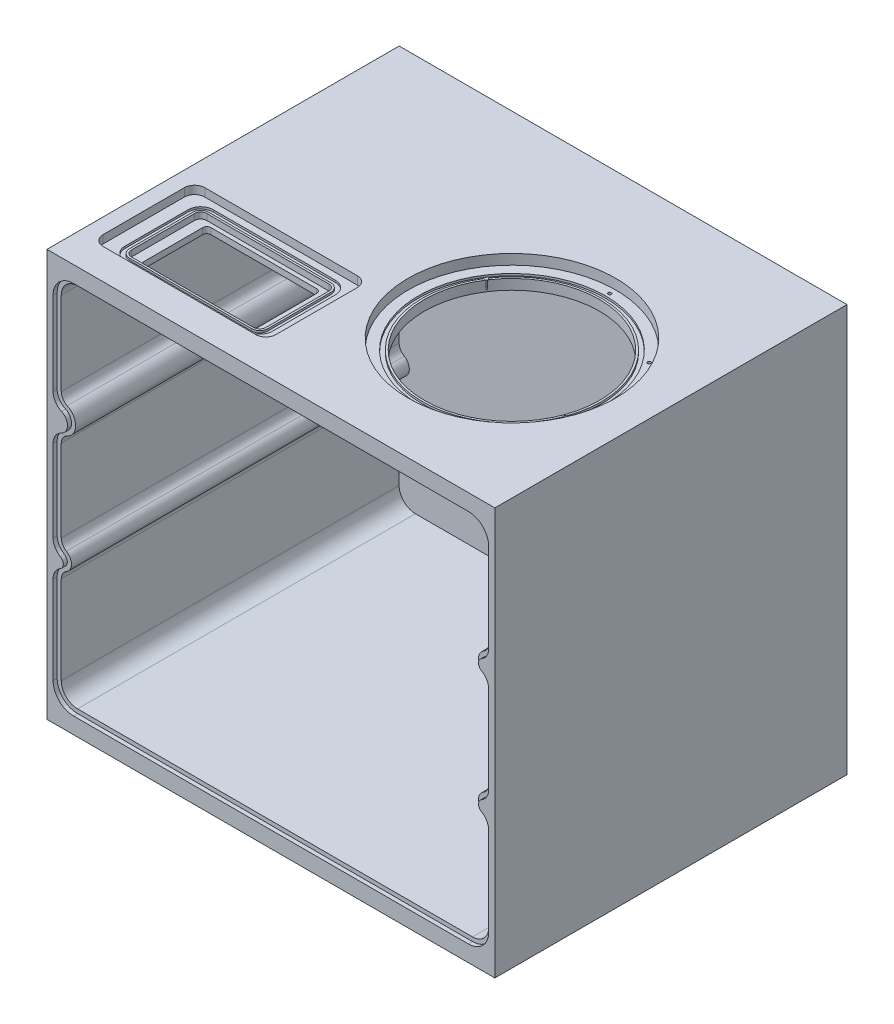
from build123d import *

# Parameters (mm, degrees)
SKETCH1_W           = 220
SKETCH1_H           = 200
BOSS_EXTRUDE1_DEPTH = 5
SKETCH1_3_W         = 220
SKETCH1_3_H         = 200
BOSS_EXTRUDE2_DEPTH = 173
FILLET1_R           = 8
FILLET2_R           = 5
SKETCH4_R           = 43
CUT_EXTRUDE3_DEPTH  = 10
SKETCH4_3_R         = 51
CUT_EXTRUDE4_DEPTH  = 5
SKETCH4_5_R         = 46
SKETCH4_5_R_2       = 44
CUT_EXTRUDE6_DEPTH  = 6
CUT_EXTRUDE9_DEPTH  = 2
SKETCH5_R           = 0.7835
CUT_EXTRUDE7_DEPTH  = 4
SKETCH6_W           = 56
SKETCH6_H           = 33
CUT_EXTRUDE8_DEPTH  = 10
SKETCH6_3_W         = 85
SKETCH6_3_H         = 50
CUT_EXTRUDE10_DEPTH = 4
SKETCH6_4_W         = 66
SKETCH6_4_H         = 37
SKETCH6_4_W_2       = 56
SKETCH6_4_H_2       = 33
CUT_EXTRUDE11_DEPTH = 7
SKETCH6_5_W         = 72.4
SKETCH6_5_H         = 43.4
SKETCH6_5_W_2       = 68
SKETCH6_5_H_2       = 39
CUT_EXTRUDE12_DEPTH = 5
FILLET3_R           = 2
FILLET4_R           = 3
FILLET5_R           = 4
FILLET6_R           = 6.2
FILLET7_R           = 5


with BuildPart() as part:
    # Sketch1 → Boss-Extrude1 (new body)
    with BuildSketch(Plane.XY):
        Rectangle(SKETCH1_W, SKETCH1_H)
    extrude(amount=BOSS_EXTRUDE1_DEPTH)

    # Sketch1<3> → Boss-Extrude2 (add)
    with BuildSketch(Plane.XY):
        Rectangle(SKETCH1_3_W, SKETCH1_3_H)
        with BuildLine():
            Line((-105, 22.92983697), (-105, -25))
            ThreePointArc((-105, -25), (-100, -30), (-105, -35))
            Line((-105, -35), (-105, -90))
            Line((-105, -90), (105, -90))
            Line((105, -90), (105, -35))
            ThreePointArc((105, -35), (100, -30), (105, -25))
            Line((105, -25), (105, 25))
            ThreePointArc((105, 25), (100, 30), (105, 35))
            Line((105, 35), (105, 90))
            Line((105, 90), (-105, 90))
            Line((-105, 90), (-105, 37.07016303))
            ThreePointArc((-105, 37.07016303), (-97.92983697, 30), (-105, 22.92983697))
        make_face(mode=Mode.SUBTRACT)
    extrude(amount=BOSS_EXTRUDE2_DEPTH)

    # Fillet1
    fillet1_edges = [part.edges().sort_by_distance(p)[0] for p in [
        (105, -90, 89),
        (-105, -90, 89),
        (105, 90, 89),
        (-105, 90, 89),
    ]]
    fillet(fillet1_edges, radius=FILLET1_R)

    # Fillet2
    fillet2_edges = [part.edges().sort_by_distance(p)[0] for p in [
        (105, -35, 89),
        (105, -25, 89),
        (105, 35, 89),
        (105, 25, 89),
        (-105, 37.07016303, 89),
        (-105, 22.92983697, 89),
        (-105, -25, 89),
        (-105, -35, 89),
    ]]
    fillet(fillet2_edges, radius=FILLET2_R)

    # Sketch4 → Cut-Extrude3 (cut)
    with BuildSketch(Plane(origin=(0, 100, 0), x_dir=(1, 0, 0), z_dir=(0, 1, 0))):
        with Locations((42, -96.6)):
            Circle(SKETCH4_R)
    extrude(amount=-CUT_EXTRUDE3_DEPTH, mode=Mode.SUBTRACT)

    # Sketch4<3> → Cut-Extrude4 (cut)
    with BuildSketch(Plane(origin=(0, 100, 0), x_dir=(1, 0, 0), z_dir=(0, 1, 0))):
        with Locations((42, -96.6)):
            Circle(SKETCH4_3_R)
    extrude(amount=-CUT_EXTRUDE4_DEPTH, mode=Mode.SUBTRACT)

    # Sketch4<5> → Cut-Extrude6 (cut)
    with BuildSketch(Plane(origin=(0, 100, 0), x_dir=(1, 0, 0), z_dir=(0, 1, 0))):
        with Locations((42, -96.6)):
            Circle(SKETCH4_5_R)
        with Locations((42, -96.6)):
            Circle(SKETCH4_5_R_2, mode=Mode.SUBTRACT)
    extrude(amount=-CUT_EXTRUDE6_DEPTH, mode=Mode.SUBTRACT)

    # Sketch2 → Cut-Extrude9 (cut)
    with BuildSketch(Plane.XY.offset(173)):
        with BuildLine():
            Line((107, -82), (107, -38.660254038))
            ThreePointArc((107, -38.660254038), (106.062177826, -35.160254038), (103.5, -32.598076211))
            ThreePointArc((103.5, -32.598076211), (102, -30), (103.5, -27.401923789))
            ThreePointArc((103.5, -27.401923789), (106.062177826, -24.839745962), (107, -21.339745962))
            Line((107, -21.339745962), (107, 21.339745962))
            ThreePointArc((107, 21.339745962), (106.062177826, 24.839745962), (103.5, 27.401923789))
            ThreePointArc((103.5, 27.401923789), (102, 30), (103.5, 32.598076211))
            ThreePointArc((103.5, 32.598076211), (106.062177826, 35.160254038), (107, 38.660254038))
            Line((107, 38.660254038), (107, 82))
            ThreePointArc((107, 82), (104.071067812, 89.071067812), (97, 92))
            Line((97, 92), (-97, 92))
            ThreePointArc((-97, 92), (-104.071067812, 89.071067812), (-107, 82))
            Line((-107, 82), (-107, 40.985847057))
            ThreePointArc((-107, 40.985847057), (-105.886339524, 37.197574759), (-102.899712283, 34.614687926))
            ThreePointArc((-102.899712283, 34.614687926), (-99.92983697, 30), (-102.899712283, 25.385312074))
            ThreePointArc((-102.899712283, 25.385312074), (-105.886339524, 22.802425241), (-107, 19.014152943))
            Line((-107, 19.014152943), (-107, -21.339745962))
            ThreePointArc((-107, -21.339745962), (-106.062177826, -24.839745962), (-103.5, -27.401923789))
            ThreePointArc((-103.5, -27.401923789), (-102, -30), (-103.5, -32.598076211))
            ThreePointArc((-103.5, -32.598076211), (-106.062177826, -35.160254038), (-107, -38.660254038))
            Line((-107, -38.660254038), (-107, -82))
            ThreePointArc((-107, -82), (-104.071067812, -89.071067812), (-97, -92))
            Line((-97, -92), (97, -92))
            ThreePointArc((97, -92), (104.071067812, -89.071067812), (107, -82))
        make_face()
        with BuildLine():
            Line((105, -82), (105, -38.660254038))
            ThreePointArc((105, -38.660254038), (104.330127019, -36.160254038), (102.5, -34.330127019))
            ThreePointArc((102.5, -34.330127019), (100, -30), (102.5, -25.669872981))
            ThreePointArc((102.5, -25.669872981), (104.330127019, -23.839745962), (105, -21.339745962))
            Line((105, -21.339745962), (105, 21.339745962))
            ThreePointArc((105, 21.339745962), (104.330127019, 23.839745962), (102.5, 25.669872981))
            ThreePointArc((102.5, 25.669872981), (100, 30), (102.5, 34.330127019))
            ThreePointArc((102.5, 34.330127019), (104.330127019, 36.160254038), (105, 38.660254038))
            Line((105, 38.660254038), (105, 82))
            ThreePointArc((105, 82), (102.656854249, 87.656854249), (97, 90))
            Line((97, 90), (-97, 90))
            ThreePointArc((-97, 90), (-102.656854249, 87.656854249), (-105, 82))
            Line((-105, 82), (-105, 40.985847057))
            ThreePointArc((-105, 40.985847057), (-104.204528231, 38.279938273), (-102.07122306, 36.435019107))
            ThreePointArc((-102.07122306, 36.435019107), (-97.92983697, 30), (-102.07122306, 23.564980893))
            ThreePointArc((-102.07122306, 23.564980893), (-104.204528231, 21.720061727), (-105, 19.014152943))
            Line((-105, 19.014152943), (-105, -21.339745962))
            ThreePointArc((-105, -21.339745962), (-104.330127019, -23.839745962), (-102.5, -25.669872981))
            ThreePointArc((-102.5, -25.669872981), (-100, -30), (-102.5, -34.330127019))
            ThreePointArc((-102.5, -34.330127019), (-104.330127019, -36.160254038), (-105, -38.660254038))
            Line((-105, -38.660254038), (-105, -82))
            ThreePointArc((-105, -82), (-102.656854249, -87.656854249), (-97, -90))
            Line((-97, -90), (97, -90))
            ThreePointArc((97, -90), (102.656854249, -87.656854249), (105, -82))
        make_face(mode=Mode.SUBTRACT)
    extrude(amount=-CUT_EXTRUDE9_DEPTH, mode=Mode.SUBTRACT)

    # Sketch5 → Cut-Extrude7 (cut)
    with BuildSketch(Plane(origin=(0, 95, 0), x_dir=(1, 0, 0), z_dir=(0, 1, 0))):
        with Locations((42, -48.6)):
            Circle(SKETCH5_R)
        with Locations((81.069219382, -68.269872981)):
            Circle(SKETCH5_R)
        with Locations((83.569219382, -111.939745962)):
            Circle(SKETCH5_R)
        with Locations((47, -135.939745962)):
            Circle(SKETCH5_R)
        with Locations((7.930780618, -116.269872981)):
            Circle(SKETCH5_R)
        with Locations((5.430780618, -72.6)):
            Circle(SKETCH5_R)
    extrude(amount=-CUT_EXTRUDE7_DEPTH, mode=Mode.SUBTRACT)

    # Sketch6 → Cut-Extrude8 (cut)
    with BuildSketch(Plane(origin=(0, 100, 0), x_dir=(1, 0, 0), z_dir=(0, 1, 0))):
        with Locations((-60, -133)):
            Rectangle(SKETCH6_W, SKETCH6_H)
    extrude(amount=-CUT_EXTRUDE8_DEPTH, mode=Mode.SUBTRACT)

    # Sketch6<3> → Cut-Extrude10 (cut)
    with BuildSketch(Plane(origin=(0, 100, 0), x_dir=(1, 0, 0), z_dir=(0, 1, 0))):
        with Locations((-60, -133)):
            Rectangle(SKETCH6_3_W, SKETCH6_3_H)
    extrude(amount=-CUT_EXTRUDE10_DEPTH, mode=Mode.SUBTRACT)

    # Sketch6<4> → Cut-Extrude11 (cut)
    with BuildSketch(Plane(origin=(0, 100, 0), x_dir=(1, 0, 0), z_dir=(0, 1, 0))):
        with Locations((-60, -133)):
            Rectangle(SKETCH6_4_W, SKETCH6_4_H)
        with Locations((-60, -133)):
            Rectangle(SKETCH6_4_W_2, SKETCH6_4_H_2, mode=Mode.SUBTRACT)
    extrude(amount=-CUT_EXTRUDE11_DEPTH, mode=Mode.SUBTRACT)

    # Sketch6<5> → Cut-Extrude12 (cut)
    with BuildSketch(Plane(origin=(0, 100, 0), x_dir=(1, 0, 0), z_dir=(0, 1, 0))):
        with Locations((-60, -133)):
            Rectangle(SKETCH6_5_W, SKETCH6_5_H)
        with Locations((-60, -133)):
            Rectangle(SKETCH6_5_W_2, SKETCH6_5_H_2, mode=Mode.SUBTRACT)
    extrude(amount=-CUT_EXTRUDE12_DEPTH, mode=Mode.SUBTRACT)

    # Fillet3
    fillet3_edges = [part.edges().sort_by_distance(p)[0] for p in [
        (-32, 91.5, 149.5),
        (-88, 91.5, 149.5),
        (-32, 91.5, 116.5),
        (-88, 91.5, 116.5),
    ]]
    fillet(fillet3_edges, radius=FILLET3_R)

    # Fillet4
    fillet4_edges = [part.edges().sort_by_distance(p)[0] for p in [
        (-27, 94.5, 151.5),
        (-93, 94.5, 151.5),
        (-27, 94.5, 114.5),
        (-93, 94.5, 114.5),
    ]]
    fillet(fillet4_edges, radius=FILLET4_R)

    # Fillet5
    fillet5_edges = [part.edges().sort_by_distance(p)[0] for p in [
        (-26, 95.5, 152.5),
        (-26, 95.5, 113.5),
        (-94, 95.5, 152.5),
        (-94, 95.5, 113.5),
    ]]
    fillet(fillet5_edges, radius=FILLET5_R)

    # Fillet6
    fillet6_edges = [part.edges().sort_by_distance(p)[0] for p in [
        (-23.8, 95.5, 154.7),
        (-96.2, 95.5, 154.7),
        (-23.8, 95.5, 111.3),
        (-96.2, 95.5, 111.3),
    ]]
    fillet(fillet6_edges, radius=FILLET6_R)

    # Fillet7
    fillet7_edges = [part.edges().sort_by_distance(p)[0] for p in [
        (-17.5, 98, 158),
        (-102.5, 98, 158),
        (-17.5, 98, 108),
        (-102.5, 98, 108),
    ]]
    fillet(fillet7_edges, radius=FILLET7_R)


solid = part.part
